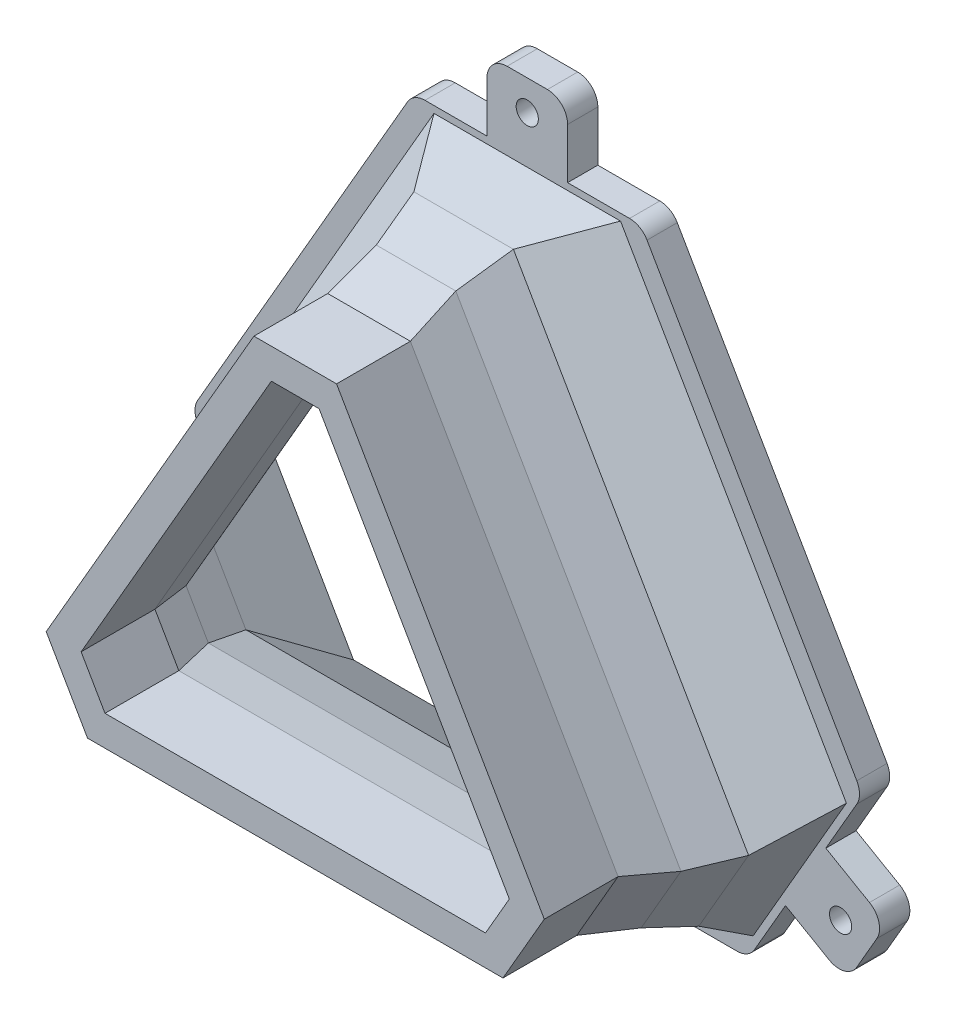
from build123d import *

# Parameters (mm, degrees)
BOSS_EXTRUDE1_DEPTH     = 7.32
BOSS_EXTRUDE6_START     = -3
BOSS_EXTRUDE6_OUTLINE_R = 1.1
BOSS_EXTRUDE6_DEPTH     = 3
FILLET2_R               = 2


# Read off the part's stored shape, not the designer's step: Boss-Extrude6
with BuildPart() as part:
    # Sketch1 → Boss-Extrude1 (new body)
    with BuildSketch(Plane.XY):
        Polygon((-20.599186911, -16.626279442), (20.599186911, -16.626279442), (24.698373822, -9.526279442), (4.099186911, 26.152558883), (-4.099186911, 26.152558883), (-24.698373822, -9.526279442), align=None)
        Polygon((18.867136104, -13.626279442), (21.234272207, -9.526279442), (2.367136104, 23.152558883), (-2.367136104, 23.152558883), (-21.234272207, -9.526279442), (-18.867136104, -13.626279442), align=None, mode=Mode.SUBTRACT)
    extrude(amount=BOSS_EXTRUDE1_DEPTH)


with BuildPart() as body_2:
    # Sketch1<14> → Loft3 section 0
    with BuildSketch(Plane.XY):
        with BuildLine():
            Line((-4.099186911, 26.152558883), (-24.698373822, -9.526279442))
            Line((-24.698373822, -9.526279442), (-20.599186911, -16.626279442))
            Line((-20.599186911, -16.626279442), (20.599186911, -16.626279442))
            Line((20.599186911, -16.626279442), (24.698373822, -9.526279442))
            Line((24.698373822, -9.526279442), (4.099186911, 26.152558883))
            Line((4.099186911, 26.152558883), (-4.099186911, 26.152558883))
        make_face()
    # Sketch5 → Loft3 section 1
    with BuildSketch(Plane.XY.offset(-4.66)):
        with BuildLine():
            Line((-3.943302339, 28.062558883), (-26.274540057, -10.616279442))
            Line((-26.274540057, -10.616279442), (-22.331237719, -17.446279442))
            Line((-22.331237719, -17.446279442), (22.331237719, -17.446279442))
            Line((22.331237719, -17.446279442), (26.274540057, -10.616279442))
            Line((26.274540057, -10.616279442), (3.943302339, 28.062558883))
            Line((3.943302339, 28.062558883), (-3.943302339, 28.062558883))
        make_face()
    loft()

    # Sketch5<46> → Loft4 section 0
    with BuildSketch(Plane.XY.offset(-4.66)):
        with BuildLine():
            Line((-3.943302339, 28.062558883), (-26.274540057, -10.616279442))
            Line((-26.274540057, -10.616279442), (-22.331237719, -17.446279442))
            Line((-22.331237719, -17.446279442), (22.331237719, -17.446279442))
            Line((22.331237719, -17.446279442), (26.274540057, -10.616279442))
            Line((26.274540057, -10.616279442), (3.943302339, 28.062558883))
            Line((3.943302339, 28.062558883), (-3.943302339, 28.062558883))
        make_face()
    # Sketch13 → Loft4 section 1
    with BuildSketch(Plane.XY.offset(-9.38)):
        with BuildLine():
            Line((-4.936344802, 29.782558883), (-28.260624983, -10.616279442))
            Line((-28.260624983, -10.616279442), (-23.324280182, -19.166279442))
            Line((-23.324280182, -19.166279442), (23.324280182, -19.166279442))
            Line((23.324280182, -19.166279442), (28.260624983, -10.616279442))
            Line((28.260624983, -10.616279442), (4.936344802, 29.782558883))
            Line((4.936344802, 29.782558883), (-4.936344802, 29.782558883))
        make_face()
    loft()

    # Sketch13<4> → Loft5 section 0
    with BuildSketch(Plane.XY.offset(-9.38)):
        with BuildLine():
            Line((-4.936344802, 29.782558883), (-28.260624983, -10.616279442))
            Line((-28.260624983, -10.616279442), (-23.324280182, -19.166279442))
            Line((-23.324280182, -19.166279442), (23.324280182, -19.166279442))
            Line((23.324280182, -19.166279442), (28.260624983, -10.616279442))
            Line((28.260624983, -10.616279442), (4.936344802, 29.782558883))
            Line((4.936344802, 29.782558883), (-4.936344802, 29.782558883))
        make_face()
    # Sketch14 → Loft5 section 1
    with BuildSketch(Plane.XY.offset(-18.69)):
        with BuildLine():
            Line((11.3, 31.880384758), (-11.3, 31.880384758))
            Line((-11.3, 31.880384758), (-33.259223083, -6.154105316))
            Line((-33.259223083, -6.154105316), (-21.959223083, -25.726279442))
            Line((-21.959223083, -25.726279442), (21.959223083, -25.726279442))
            Line((21.959223083, -25.726279442), (33.259223083, -6.154105316))
            Line((33.259223083, -6.154105316), (11.3, 31.880384758))
        make_face()
    loft()

    # Sketch1<15> → Cut-Loft1 section 0
    with BuildSketch(Plane.XY):
        with BuildLine():
            Line((-2.367136104, 23.152558883), (2.367136104, 23.152558883))
            Line((2.367136104, 23.152558883), (21.234272207, -9.526279442))
            Line((21.234272207, -9.526279442), (18.867136104, -13.626279442))
            Line((18.867136104, -13.626279442), (-18.867136104, -13.626279442))
            Line((-18.867136104, -13.626279442), (-21.234272207, -9.526279442))
            Line((-21.234272207, -9.526279442), (-2.367136104, 23.152558883))
        make_face()
    # Sketch5<47> → Cut-Loft1 section 1
    with BuildSketch(Plane.XY.offset(-4.66)):
        with BuildLine():
            Line((2.211251531, 25.062558883), (22.810438442, -10.616279442))
            Line((22.810438442, -10.616279442), (20.599186911, -14.446279442))
            Line((20.599186911, -14.446279442), (-20.599186911, -14.446279442))
            Line((-20.599186911, -14.446279442), (-22.810438442, -10.616279442))
            Line((-22.810438442, -10.616279442), (-2.211251531, 25.062558883))
            Line((-2.211251531, 25.062558883), (2.211251531, 25.062558883))
        make_face()
    loft(mode=Mode.SUBTRACT)

    # Sketch14<5> → Cut-Loft2 section 0
    with BuildSketch(Plane.XY.offset(-18.69)):
        with BuildLine():
            Line((29.795121467, -6.154105316), (9.567949192, 28.880384758))
            Line((9.567949192, 28.880384758), (-9.567949192, 28.880384758))
            Line((-9.567949192, 28.880384758), (-29.795121467, -6.154105316))
            Line((-29.795121467, -6.154105316), (-20.227172275, -22.726279442))
            Line((-20.227172275, -22.726279442), (20.227172275, -22.726279442))
            Line((20.227172275, -22.726279442), (29.795121467, -6.154105316))
        make_face()
    # Sketch13<5> → Cut-Loft2 section 1
    with BuildSketch(Plane.XY.offset(-9.38)):
        with BuildLine():
            Line((-24.796523368, -10.616279442), (-21.592229374, -16.166279442))
            Line((-21.592229374, -16.166279442), (21.592229374, -16.166279442))
            Line((21.592229374, -16.166279442), (24.796523368, -10.616279442))
            Line((24.796523368, -10.616279442), (3.204293994, 26.782558883))
            Line((3.204293994, 26.782558883), (-3.204293994, 26.782558883))
            Line((-3.204293994, 26.782558883), (-24.796523368, -10.616279442))
        make_face()
    loft(mode=Mode.SUBTRACT)

    # Sketch13<6> → Cut-Loft3 section 0
    with BuildSketch(Plane.XY.offset(-9.38)):
        with BuildLine():
            Line((-24.796523368, -10.616279442), (-21.592229374, -16.166279442))
            Line((-21.592229374, -16.166279442), (21.592229374, -16.166279442))
            Line((21.592229374, -16.166279442), (24.796523368, -10.616279442))
            Line((24.796523368, -10.616279442), (3.204293994, 26.782558883))
            Line((3.204293994, 26.782558883), (-3.204293994, 26.782558883))
            Line((-3.204293994, 26.782558883), (-24.796523368, -10.616279442))
        make_face()
    # Sketch5<48> → Cut-Loft3 section 1
    with BuildSketch(Plane.XY.offset(-4.66)):
        with BuildLine():
            Line((2.211251531, 25.062558883), (22.810438442, -10.616279442))
            Line((22.810438442, -10.616279442), (20.599186911, -14.446279442))
            Line((20.599186911, -14.446279442), (-20.599186911, -14.446279442))
            Line((-20.599186911, -14.446279442), (-22.810438442, -10.616279442))
            Line((-22.810438442, -10.616279442), (-2.211251531, 25.062558883))
            Line((-2.211251531, 25.062558883), (2.211251531, 25.062558883))
        make_face()
    loft(mode=Mode.SUBTRACT)

    # Boss-Extrude6 outline → Boss-Extrude6 (add)
    with BuildSketch(Plane(origin=(0, 0, -18.69), x_dir=(-1, 0, 0), z_dir=(0, 0, -1)).offset(BOSS_EXTRUDE6_START)):
        Polygon((33.259223083, -6.154105316), (11.3, 31.880384758), (4, 31.880384758), (4, 38.880384758), (-4, 38.880384758), (-4, 31.880384758), (-11.3, 31.880384758), (-33.259223083, -6.154105316), (-29.609223083, -12.476090764), (-35.671400909, -15.976090764), (-31.671400909, -22.904293994), (-25.609223083, -19.404293994), (-21.959223083, -25.726279442), (21.959223083, -25.726279442), (25.609223083, -19.404293994), (31.671400909, -22.904293994), (35.671400909, -15.976090764), (29.609223083, -12.476090764), align=None)
        Polygon((-20.227172275, -22.726279442), (-29.795121467, -6.154105316), (-9.567949192, 28.880384758), (9.567949192, 28.880384758), (29.795121467, -6.154105316), (20.227172275, -22.726279442), align=None, mode=Mode.SUBTRACT)
        with Locations((31.073324698, -17.940192379)):
            Circle(BOSS_EXTRUDE6_OUTLINE_R, mode=Mode.SUBTRACT)
        with Locations((-31.073324698, -17.940192379)):
            Circle(BOSS_EXTRUDE6_OUTLINE_R, mode=Mode.SUBTRACT)
        with Locations((0, 35.880384758)):
            Circle(BOSS_EXTRUDE6_OUTLINE_R, mode=Mode.SUBTRACT)
    extrude(amount=BOSS_EXTRUDE6_DEPTH)

    # Fillet2
    fillet2_edges = [body_2.edges().sort_by_distance(p)[0] for p in [
        (-11.3, 31.880384758, -17.19),
        (-33.259223083, -6.154105316, -17.19),
        (-35.671400909, -15.976090764, -17.19),
        (-31.671400909, -22.904293994, -17.19),
        (-21.959223083, -25.726279442, -17.19),
        (21.959223083, -25.726279442, -17.19),
        (31.671400909, -22.904293994, -17.19),
        (35.671400909, -15.976090764, -17.19),
        (33.259223083, -6.154105316, -17.19),
        (11.3, 31.880384758, -17.19),
        (4, 38.880384758, -17.19),
        (-4, 38.880384758, -17.19),
    ]]
    fillet(fillet2_edges, radius=FILLET2_R)


solid = Compound([part.part, body_2.part])
